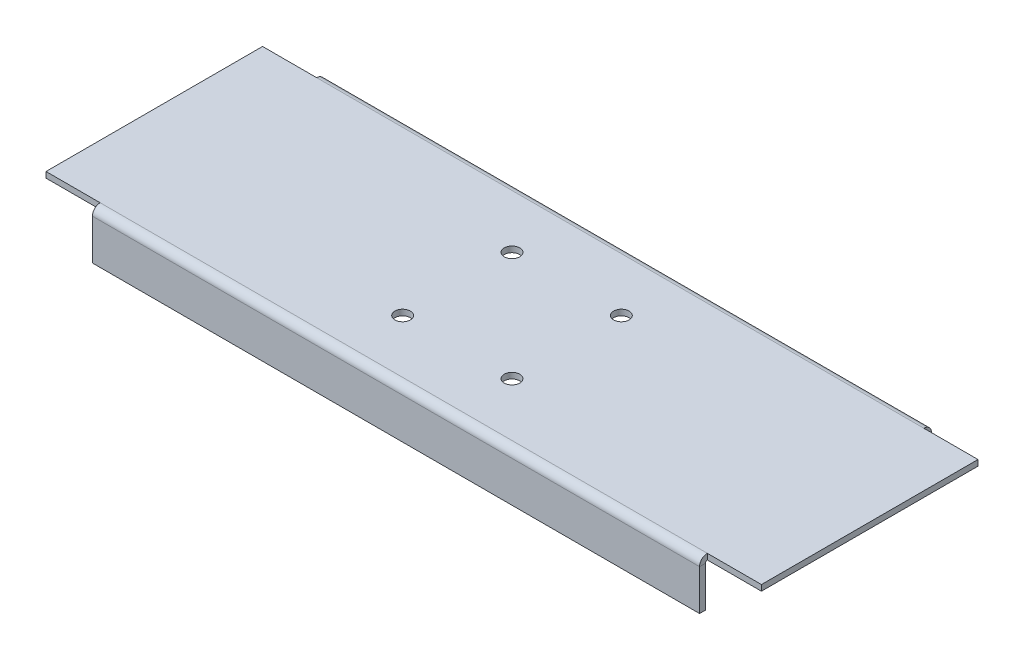
from build123d import *

# Parameters (mm, degrees)
SKETCH1_W                      = 370
SKETCH1_H                      = 114
SKETCH1_R                      = 4
BOSS_EXTRUDE1_DEPTH            = 3
EDGE_FLANGE1_STRIP_W           = 14
EDGE_FLANGE1_STRIP_H           = 3
EDGE_FLANGE1_STRIP_CUT_DEPTH   = 370
EDGE_FLANGE1_STRIP_2_W         = 14
EDGE_FLANGE1_STRIP_2_H         = 3
EDGE_FLANGE1_STRIP_CUT_2_DEPTH = 370
EDGE_FLANGE1_DEPTH             = 370
EDGE_FLANGE1_BEND_DEPTH        = 370
CUT_EXTRUDE2_START             = -185
CUT_EXTRUDE2_DEPTH             = 28
CUT_EXTRUDE2_START_2           = 157
CUT_EXTRUDE2_2_DEPTH           = 28


# Read off the part's stored shape, not the designer's step: Cut-Extrude2
# Sheet-metal steps are written as plain solids
with BuildPart() as part:
    # Sketch1 → Boss-Extrude1 (new body)
    with BuildSketch(Plane(origin=(0, 0, 0), x_dir=(1, 0, 0), z_dir=(0, 1, 0))):
        Rectangle(SKETCH1_W, SKETCH1_H)
        with Locations(Location((-28.284271247, 28.284271247, 0), (0, 0, 270))):
            Circle(SKETCH1_R, mode=Mode.SUBTRACT)
        with Locations(Location((28.284271247, 28.284271247, 0), (0, 0, 270))):
            Circle(SKETCH1_R, mode=Mode.SUBTRACT)
        with Locations(Location((28.284271247, -28.284271247, 0), (0, 0, 270))):
            Circle(SKETCH1_R, mode=Mode.SUBTRACT)
        with Locations(Location((-28.284271247, -28.284271247, 0), (0, 0, 270))):
            Circle(SKETCH1_R, mode=Mode.SUBTRACT)
    extrude(amount=BOSS_EXTRUDE1_DEPTH)

    # Edge-Flange1 strip (across the edge) → Edge-Flange1 strip cut (cut)
    with BuildSketch(Plane(origin=(185, 0, 57), x_dir=(0, 0, -1), z_dir=(-1, 0, 0))):
        with Locations((-6, -1.5)):
            Rectangle(EDGE_FLANGE1_STRIP_W, EDGE_FLANGE1_STRIP_H)
    extrude(amount=EDGE_FLANGE1_STRIP_CUT_DEPTH, mode=Mode.SUBTRACT)

    # Edge-Flange1 strip 2 (across the edge) → Edge-Flange1 strip cut 2 (cut)
    with BuildSketch(Plane(origin=(-185, 0, -57), x_dir=(0, 0, 1), z_dir=(1, 0, 0))):
        with Locations((-6, -1.5)):
            Rectangle(EDGE_FLANGE1_STRIP_2_W, EDGE_FLANGE1_STRIP_2_H)
    extrude(amount=EDGE_FLANGE1_STRIP_CUT_2_DEPTH, mode=Mode.SUBTRACT)

    # Edge-Flange1 section (across the edge) → Edge-Flange1 (add)
    with BuildSketch(Plane(origin=(185, 0, 57), x_dir=(0, 0, -1), z_dir=(-1, 0, 0))):
        with BuildLine():
            Line((-3, 1), (-3, 22))
            Line((-3, 22), (0, 22))
            Line((0, 22), (0, 1))
            ThreePointArc((0, 1), (0.292893219, 0.292893219), (1, 0))
            Line((1, 0), (1, -3))
            ThreePointArc((1, -3), (-1.828427125, -1.828427125), (-3, 1))
        make_face()
    extrude(amount=EDGE_FLANGE1_DEPTH)

    # Edge-Flange1 section 2 (across the edge) → Edge-Flange1 bend (add)
    with BuildSketch(Plane(origin=(-185, 0, -57), x_dir=(0, 0, 1), z_dir=(1, 0, 0))):
        with BuildLine():
            Line((-3, 1), (-3, 22))
            Line((-3, 22), (0, 22))
            Line((0, 22), (0, 1))
            ThreePointArc((0, 1), (0.292893219, 0.292893219), (1, 0))
            Line((1, 0), (1, -3))
            ThreePointArc((1, -3), (-1.828427125, -1.828427125), (-3, 1))
        make_face()
    extrude(amount=EDGE_FLANGE1_BEND_DEPTH)

    # Cut-Extrude2 outline → Cut-Extrude2 (cut)
    with BuildSketch(Plane.YZ.offset(CUT_EXTRUDE2_START)):
        with BuildLine():
            ThreePointArc((-1, -60), (1.828427125, -58.828427125), (3, -56))
            Line((3, -56), (0, -56))
            ThreePointArc((0, -56), (-0.292893219, -56.707106781), (-1, -57))
            Line((-1, -57), (-22, -57))
            Line((-22, -57), (-22, -60))
            Line((-22, -60), (-1, -60))
        make_face()
        with BuildLine():
            ThreePointArc((-1, 57), (-0.292893219, 56.707106781), (0, 56))
            Line((0, 56), (3, 56))
            ThreePointArc((3, 56), (1.828427125, 58.828427125), (-1, 60))
            Line((-1, 60), (-22, 60))
            Line((-22, 60), (-22, 57))
            Line((-22, 57), (-1, 57))
        make_face()
    extrude(amount=CUT_EXTRUDE2_DEPTH, mode=Mode.SUBTRACT)

    # Cut-Extrude2 2 outline → Cut-Extrude2 2 (cut)
    with BuildSketch(Plane.YZ.offset(CUT_EXTRUDE2_START_2)):
        with BuildLine():
            ThreePointArc((-1, -60), (1.828427125, -58.828427125), (3, -56))
            Line((3, -56), (0, -56))
            ThreePointArc((0, -56), (-0.292893219, -56.707106781), (-1, -57))
            Line((-1, -57), (-22, -57))
            Line((-22, -57), (-22, -60))
            Line((-22, -60), (-1, -60))
        make_face()
        with BuildLine():
            ThreePointArc((-1, 57), (-0.292893219, 56.707106781), (0, 56))
            Line((0, 56), (3, 56))
            ThreePointArc((3, 56), (1.828427125, 58.828427125), (-1, 60))
            Line((-1, 60), (-22, 60))
            Line((-22, 60), (-22, 57))
            Line((-22, 57), (-1, 57))
        make_face()
    extrude(amount=CUT_EXTRUDE2_2_DEPTH, mode=Mode.SUBTRACT)


solid = part.part
